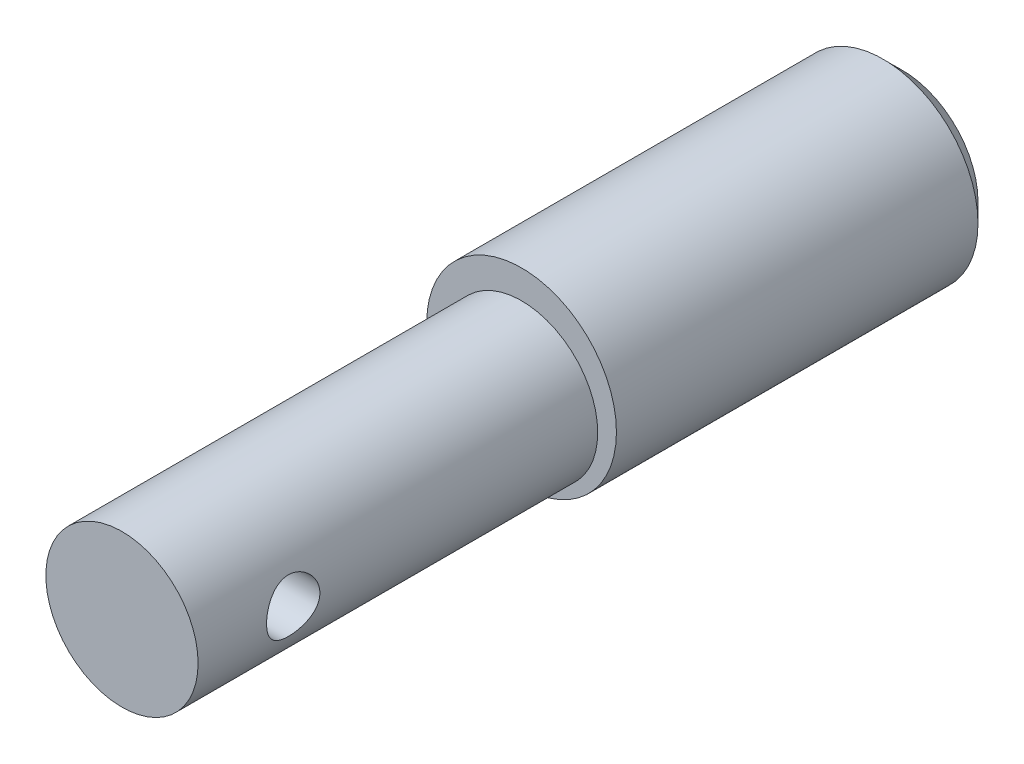
from build123d import *

# Parameters (mm, degrees)
SKETCH1_R                   = 3.95605
BASE_EXTRUDE_DEPTH          = 16.271875
CHAMFER1_SIZE               = 0.79375
SILHOUETTE_W                = 16.66875
SILHOUETTE_H                = 1.18745
LOCKING_PIN_HOLE_DEPTH      = 18.206817812
LOCKING_PIN_HOLE_DEPTH_BACK = 18.206817812
SKETCH5_R                   = 1.112153358


with BuildPart() as part:
    # Sketch1 → Base-Extrude (new, symmetric)
    with BuildSketch(Plane.XY):
        Circle(SKETCH1_R)
    extrude(amount=BASE_EXTRUDE_DEPTH, both=True)

    # Chamfer1
    chamfer1_edges = [part.edges().sort_by_distance(p)[0] for p in [
        (-3.95605, 0, -16.271875),
    ]]
    chamfer(chamfer1_edges, length=CHAMFER1_SIZE)

    # Silhouette → Cut-Revolve1 (revolve, cut)
    with BuildSketch(Plane(origin=(0, 0, 0), x_dir=(0, 0, -1), z_dir=(1, 0, 0))):
        with Locations((-7.9375, 3.362325)):
            Rectangle(SILHOUETTE_W, SILHOUETTE_H)
    revolve(axis=Axis((0, -0.4064, 13.51559633), (0, 0, -1)), mode=Mode.SUBTRACT)

    # Sketch5 → Locking pin hole (cut, two sides: drawn at the far end of the back side and taken through both)
    with BuildSketch(Plane(origin=(0, 0, 0), x_dir=(0, 0, -1), z_dir=(1, 0, 0)).offset(-LOCKING_PIN_HOLE_DEPTH_BACK)):
        with Locations((-12.303125, -0.4064)):
            Circle(SKETCH5_R)
    extrude(amount=LOCKING_PIN_HOLE_DEPTH + LOCKING_PIN_HOLE_DEPTH_BACK, mode=Mode.SUBTRACT)


solid = part.part
